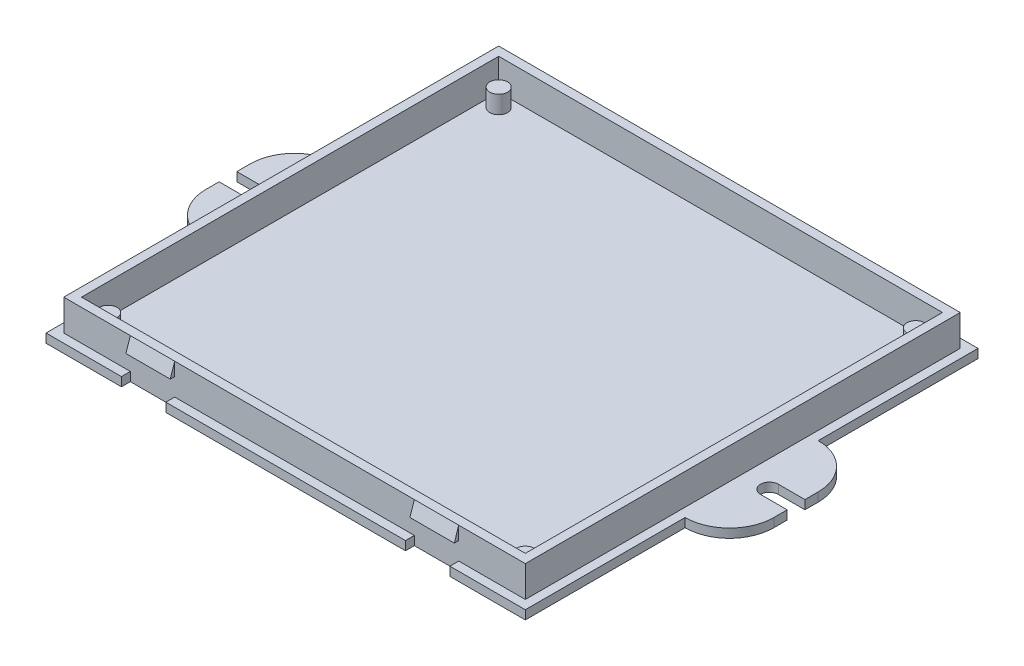
from build123d import *

# Parameters (mm, degrees)
SKETCH1_W            = 108
SKETCH1_H            = 102
BOSS_EXTRUDE1_DEPTH  = 2
SKETCH2_W            = 104
SKETCH2_H            = 98
BOSS_EXTRUDE2_DEPTH  = 7
SKETCH3_W            = 100
SKETCH3_H            = 94
CUT_EXTRUDE1_DEPTH   = 7
SKETCH4_W            = 10
SKETCH4_H            = 3
BOSS_EXTRUDE6_DEPTH  = 1
CUT_EXTRUDE2_DEPTH   = 10
SKETCH6_W            = 10
SKETCH6_H            = 3
BOSS_EXTRUDE7_DEPTH  = 1
CUT_EXTRUDE3_DEPTH   = 10
SKETCH9_W            = 10
SKETCH9_H            = 3
BOSS_EXTRUDE9_DEPTH  = 1
CUT_EXTRUDE4_DEPTH   = 10
SKETCH11_W           = 10
SKETCH11_H           = 3
BOSS_EXTRUDE10_DEPTH = 1
CUT_EXTRUDE5_DEPTH   = 10
SKETCH20_W           = 10
SKETCH20_H           = 2
CUT_EXTRUDE7_DEPTH   = 2
SKETCH21_W           = 10
SKETCH21_H           = 2
CUT_EXTRUDE8_DEPTH   = 2
SKETCH22_W           = 10
SKETCH22_H           = 2
CUT_EXTRUDE9_DEPTH   = 2
SKETCH23_W           = 10
SKETCH23_H           = 2
CUT_EXTRUDE11_DEPTH  = 2
SKETCH24_R           = 2
BOSS_EXTRUDE11_DEPTH = 4
BOSS_EXTRUDE12_DEPTH = 4
BOSS_EXTRUDE13_DEPTH = 4
BOSS_EXTRUDE14_DEPTH = 4
SKETCH28_W           = 30
SKETCH28_H           = 2
BOSS_EXTRUDE15_DEPTH = 10
SKETCH29_R           = 2
SKETCH29_W           = 6
SKETCH29_H           = 4
CUT_EXTRUDE12_DEPTH  = 2
FILLET1_R            = 10
SKETCH30_W           = 30
SKETCH30_H           = 1
BOSS_EXTRUDE16_DEPTH = 10
CUT_EXTRUDE13_DEPTH  = 2
FILLET2_R            = 10


with BuildPart() as part:
    # Sketch1 → Boss-Extrude1 (new body)
    with BuildSketch(Plane(origin=(0, 0, 0), x_dir=(1, 0, 0), z_dir=(0, 1, 0))):
        Rectangle(SKETCH1_W, SKETCH1_H)
    extrude(amount=BOSS_EXTRUDE1_DEPTH)

    # Sketch2 → Boss-Extrude2 (add)
    with BuildSketch(Plane(origin=(0, 2, 0), x_dir=(1, 0, 0), z_dir=(0, 1, 0))):
        Rectangle(SKETCH2_W, SKETCH2_H)
    extrude(amount=BOSS_EXTRUDE2_DEPTH)

    # Sketch3 → Cut-Extrude1 (cut)
    with BuildSketch(Plane(origin=(0, 9, 0), x_dir=(1, 0, 0), z_dir=(0, 1, 0))):
        Rectangle(SKETCH3_W, SKETCH3_H)
    extrude(amount=-CUT_EXTRUDE1_DEPTH, mode=Mode.SUBTRACT)

    # Sketch4 → Boss-Extrude6 (add)
    with BuildSketch(Plane.XY.offset(49)):
        with Locations((-32, 7.5)):
            Rectangle(SKETCH4_W, SKETCH4_H)
    extrude(amount=BOSS_EXTRUDE6_DEPTH)

    # Sketch5 → Cut-Extrude2 (cut)
    with BuildSketch(Plane(origin=(-27, 0, 0), x_dir=(0, 0, -1), z_dir=(1, 0, 0))):
        Polygon((-50, 6), (-49, 9), (-50, 9), align=None)
    extrude(amount=-CUT_EXTRUDE2_DEPTH, mode=Mode.SUBTRACT)

    # Sketch6 → Boss-Extrude7 (add)
    with BuildSketch(Plane.XY.offset(49)):
        with Locations((32, 7.5)):
            Rectangle(SKETCH6_W, SKETCH6_H)
    extrude(amount=BOSS_EXTRUDE7_DEPTH)

    # Sketch7 → Cut-Extrude3 (cut)
    with BuildSketch(Plane(origin=(37, 0, 0), x_dir=(0, 0, -1), z_dir=(1, 0, 0))):
        Polygon((-50, 6), (-49, 9), (-50, 9), align=None)
    extrude(amount=-CUT_EXTRUDE3_DEPTH, mode=Mode.SUBTRACT)

    # Sketch9 → Boss-Extrude9 (add)
    with BuildSketch(Plane(origin=(0, 0, -49), x_dir=(-1, 0, 0), z_dir=(0, 0, -1))):
        with Locations((-32, 7.5)):
            Rectangle(SKETCH9_W, SKETCH9_H)
    extrude(amount=BOSS_EXTRUDE9_DEPTH)

    # Sketch10 → Cut-Extrude4 (cut)
    with BuildSketch(Plane.ZY.offset(-27)):
        Polygon((-49, 9), (-50, 6), (-50, 9), align=None)
    extrude(amount=-CUT_EXTRUDE4_DEPTH, mode=Mode.SUBTRACT)

    # Sketch11 → Boss-Extrude10 (add)
    with BuildSketch(Plane(origin=(0, 0, -49), x_dir=(-1, 0, 0), z_dir=(0, 0, -1))):
        with Locations((32, 7.5)):
            Rectangle(SKETCH11_W, SKETCH11_H)
    extrude(amount=BOSS_EXTRUDE10_DEPTH)

    # Sketch12 → Cut-Extrude5 (cut)
    with BuildSketch(Plane.ZY.offset(37)):
        Polygon((-49, 9), (-50, 6), (-50, 9), align=None)
    extrude(amount=-CUT_EXTRUDE5_DEPTH, mode=Mode.SUBTRACT)

    # Sketch20 → Cut-Extrude7 (cut)
    with BuildSketch(Plane.XY.offset(51)):
        with Locations((32, 1)):
            Rectangle(SKETCH20_W, SKETCH20_H)
    extrude(amount=-CUT_EXTRUDE7_DEPTH, mode=Mode.SUBTRACT)

    # Sketch21 → Cut-Extrude8 (cut)
    with BuildSketch(Plane(origin=(0, 2, 0), x_dir=(1, 0, 0), z_dir=(0, 1, 0))):
        with Locations((-32, -50)):
            Rectangle(SKETCH21_W, SKETCH21_H)
    extrude(amount=-CUT_EXTRUDE8_DEPTH, mode=Mode.SUBTRACT)

    # Sketch22 → Cut-Extrude9 (cut)
    with BuildSketch(Plane(origin=(0, 2, 0), x_dir=(1, 0, 0), z_dir=(0, 1, 0))):
        with Locations((32, 50)):
            Rectangle(SKETCH22_W, SKETCH22_H)
    extrude(amount=-CUT_EXTRUDE9_DEPTH, mode=Mode.SUBTRACT)

    # Sketch23 → Cut-Extrude11 (cut)
    with BuildSketch(Plane(origin=(0, 2, 0), x_dir=(1, 0, 0), z_dir=(0, 1, 0))):
        with Locations((-32, 50)):
            Rectangle(SKETCH23_W, SKETCH23_H)
    extrude(amount=-CUT_EXTRUDE11_DEPTH, mode=Mode.SUBTRACT)

    # Sketch24 → Boss-Extrude11 (add)
    with BuildSketch(Plane(origin=(0, 2, 0), x_dir=(1, 0, 0), z_dir=(0, 1, 0))):
        with Locations(Location((47, 44, 0), (0, 0, 270))):
            Circle(SKETCH24_R)
    extrude(amount=BOSS_EXTRUDE11_DEPTH)

    # Sketch25 → Boss-Extrude12 (add)
    with BuildSketch(Plane(origin=(0, 2, 0), x_dir=(1, 0, 0), z_dir=(0, 1, 0))):
        with BuildLine():
            ThreePointArc((-45, 44), (-45.585786438, 45.414213562), (-47, 46))
            Line((-47, 46), (-47, 44))
            Line((-47, 44), (-49, 44))
            ThreePointArc((-49, 44), (-47, 42), (-45, 44))
        make_face()
        with BuildLine():
            Line((-47, 44), (-47, 46))
            ThreePointArc((-47, 46), (-48.414213562, 45.414213562), (-49, 44))
            Line((-49, 44), (-47, 44))
        make_face()
    extrude(amount=BOSS_EXTRUDE12_DEPTH)

    # Sketch26 → Boss-Extrude13 (add)
    with BuildSketch(Plane(origin=(0, 2, 0), x_dir=(1, 0, 0), z_dir=(0, 1, 0))):
        with BuildLine():
            ThreePointArc((-49, -44), (-48.414213562, -45.414213562), (-47, -46))
            Line((-47, -46), (-47, -44))
            Line((-47, -44), (-49, -44))
        make_face()
        with BuildLine():
            Line((-47, -44), (-47, -46))
            ThreePointArc((-47, -46), (-45.585786438, -45.414213562), (-45, -44))
            ThreePointArc((-45, -44), (-47, -42), (-49, -44))
            Line((-49, -44), (-47, -44))
        make_face()
    extrude(amount=BOSS_EXTRUDE13_DEPTH)

    # Sketch27 → Boss-Extrude14 (add)
    with BuildSketch(Plane(origin=(0, 2, 0), x_dir=(1, 0, 0), z_dir=(0, 1, 0))):
        with BuildLine():
            ThreePointArc((49, -44), (45.585786438, -42.585786438), (47, -46))
            Line((47, -46), (47, -44))
            Line((47, -44), (49, -44))
        make_face()
        with BuildLine():
            Line((47, -44), (47, -46))
            ThreePointArc((47, -46), (48.414213562, -45.414213562), (49, -44))
            Line((49, -44), (47, -44))
        make_face()
    extrude(amount=BOSS_EXTRUDE14_DEPTH)

    # Sketch28 → Boss-Extrude15 (add)
    with BuildSketch(Plane.ZY.offset(54)):
        with Locations((0, 1)):
            Rectangle(SKETCH28_W, SKETCH28_H)
    extrude(amount=BOSS_EXTRUDE15_DEPTH)

    # Sketch29 → Cut-Extrude12 (cut)
    with BuildSketch(Plane(origin=(0, 2, 0), x_dir=(1, 0, 0), z_dir=(0, 1, 0))):
        with Locations((-58, 0)):
            Circle(SKETCH29_R)
        with Locations((-61, 0)):
            Rectangle(SKETCH29_W, SKETCH29_H)
    extrude(amount=-CUT_EXTRUDE12_DEPTH, mode=Mode.SUBTRACT)

    # Fillet1
    fillet1_edges = [part.edges().sort_by_distance(p)[0] for p in [
        (-64, 1, 15),
        (-64, 1, -15),
    ]]
    fillet(fillet1_edges, radius=FILLET1_R - 0.0001)  # a hair under: the kernel refuses the full size

    # Sketch30 → Boss-Extrude16 (add)
    with BuildSketch(Plane(origin=(54, 0, 0), x_dir=(0, 0, -1), z_dir=(1, 0, 0))):
        with Locations((0, 1.5)):
            Rectangle(SKETCH30_W, SKETCH30_H)
        with Locations((0, 0.5)):
            Rectangle(SKETCH30_W, SKETCH30_H)
    extrude(amount=BOSS_EXTRUDE16_DEPTH)

    # Sketch32 → Cut-Extrude13 (cut)
    with BuildSketch(Plane(origin=(0, 2, 0), x_dir=(1, 0, 0), z_dir=(0, 1, 0))):
        with BuildLine():
            Line((58, -2), (64, -2))
            Line((64, -2), (64, 2))
            Line((64, 2), (58, 2))
            ThreePointArc((58, 2), (59.414213562, 1.414213562), (60, 0))
            ThreePointArc((60, 0), (59.414213562, -1.414213562), (58, -2))
        make_face()
        with BuildLine():
            ThreePointArc((58, 2), (56, 0), (58, -2))
            Line((58, -2), (58, 2))
        make_face()
        with BuildLine():
            Line((58, 2), (58, -2))
            ThreePointArc((58, -2), (59.414213562, -1.414213562), (60, 0))
            ThreePointArc((60, 0), (59.414213562, 1.414213562), (58, 2))
        make_face()
    extrude(amount=-CUT_EXTRUDE13_DEPTH, mode=Mode.SUBTRACT)

    # Fillet2
    fillet2_edges = [part.edges().sort_by_distance(p)[0] for p in [
        (64, 1, -15),
        (64, 1, 15),
    ]]
    fillet(fillet2_edges, radius=FILLET2_R - 0.0001)  # a hair under: the kernel refuses the full size


solid = part.part
